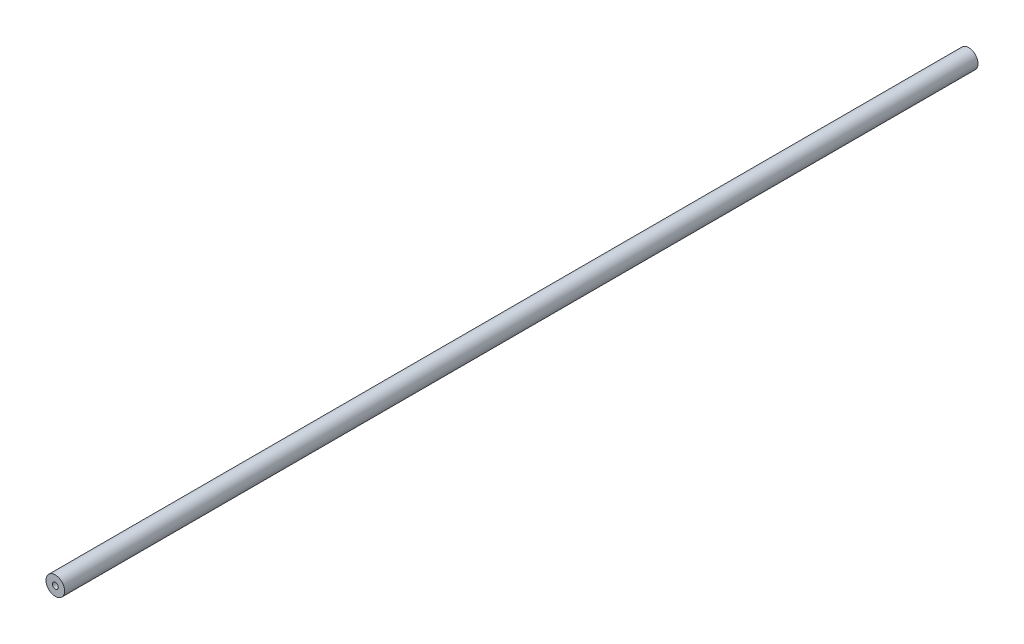
from build123d import *

# Parameters (mm, degrees)
SKETCH1_R                  = 6.35
BOSS_EXTRUDE1_DEPTH        = 622.3
F_10_32_TAPPED_HOLE1_D     = 4.0386
F_10_32_TAPPED_HOLE1_DEPTH = 13.716
F_10_32_TAPPED_HOLE1_TIP   = 1.213317848
F_10_32_TAPPED_HOLE2_D     = 4.0386
F_10_32_TAPPED_HOLE2_DEPTH = 13.716
F_10_32_TAPPED_HOLE2_TIP   = 1.213317848


with BuildPart() as part:
    # Sketch1 → Boss-Extrude1 (new body)
    with BuildSketch(Plane.XY):
        Circle(SKETCH1_R)
    extrude(amount=BOSS_EXTRUDE1_DEPTH)

    # #10-32 Tapped Hole1
    with Locations(Plane.XY.offset(622.3)):
        with Locations((0, 0)):
            Hole(F_10_32_TAPPED_HOLE1_D / 2, depth=F_10_32_TAPPED_HOLE1_DEPTH)
            with Locations((0, 0, -(F_10_32_TAPPED_HOLE1_DEPTH + F_10_32_TAPPED_HOLE1_TIP / 2))):  # 118° drill point
                Cone(0, F_10_32_TAPPED_HOLE1_D / 2, F_10_32_TAPPED_HOLE1_TIP, mode=Mode.SUBTRACT)

    # #10-32 Tapped Hole2
    with Locations(Plane(origin=(0, 0, 0), x_dir=(-1, 0, 0), z_dir=(0, 0, -1))):
        with Locations((0, 0)):
            Hole(F_10_32_TAPPED_HOLE2_D / 2, depth=F_10_32_TAPPED_HOLE2_DEPTH)
            with Locations((0, 0, -(F_10_32_TAPPED_HOLE2_DEPTH + F_10_32_TAPPED_HOLE2_TIP / 2))):  # 118° drill point
                Cone(0, F_10_32_TAPPED_HOLE2_D / 2, F_10_32_TAPPED_HOLE2_TIP, mode=Mode.SUBTRACT)


solid = part.part
